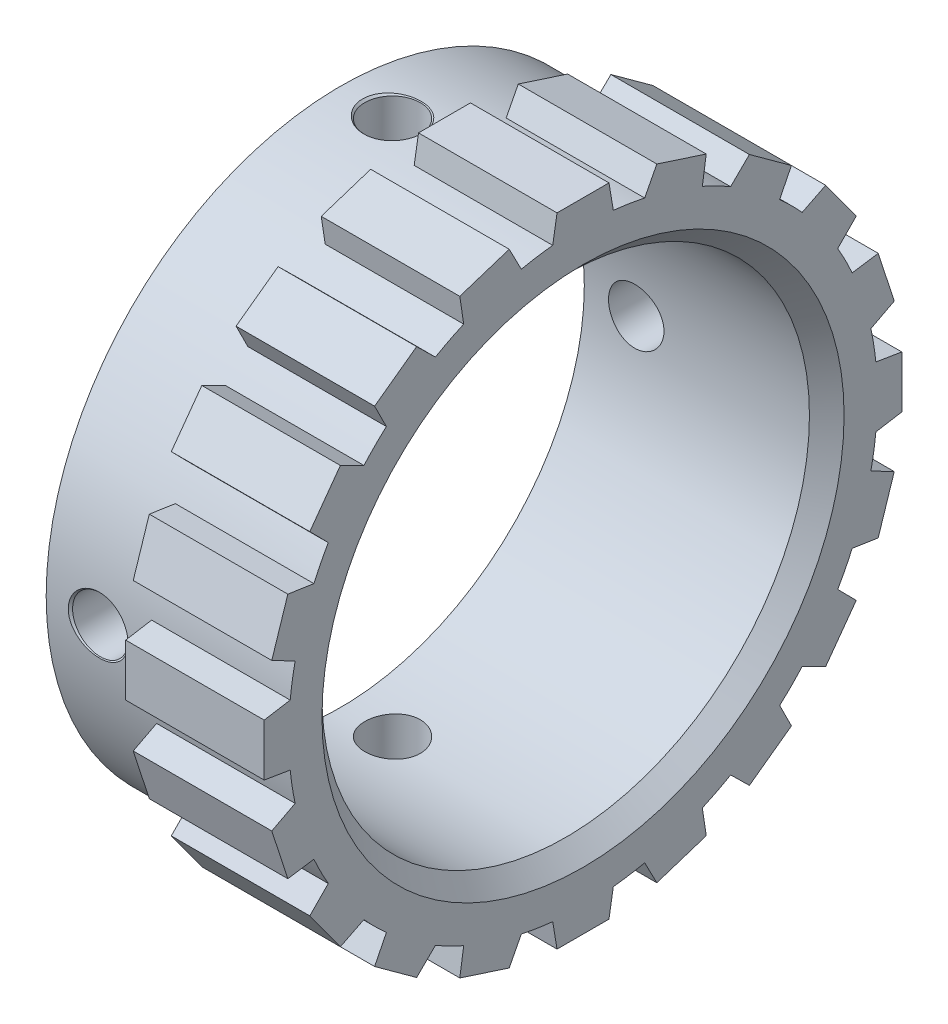
from build123d import *

# Parameters (mm, degrees)
SKETCH3_R           = 17
SKETCH3_R_2         = 14.075
BOSS_EXTRUDE2_DEPTH = 6
CIRPATTERN1_COUNT   = 4
CHAMFER1_SIZE       = 1
BOSS_EXTRUDE3_DEPTH = 4
CUT_EXTRUDE1_DEPTH  = 8
CIRPATTERN2_COUNT   = 20


# Read off the part's stored shape, not the designer's step: M3 Clearance Hole1
with BuildPart() as part:
    # Sketch2 → Revolve1 (revolve)
    with BuildSketch(Plane(origin=(0, 0, 0), x_dir=(1, 0, 0), z_dir=(0, 1, 0))):
        Polygon((-4, 2.925), (-1.5, 2.925), (0.5, 2.925), (4, 2.925), (4, 0), (-4, 0), align=None)
    revolve(axis=Axis((0, 0, 14.075), (-1, 0, 0)))

    # Sketch3 → Boss-Extrude2 (add)
    with BuildSketch(Plane.ZY.offset(4)):
        with Locations(Location((14.075, 0, 0), (0, 0, 180))):
            Circle(SKETCH3_R)
        with Locations(Location((14.075, 0, 0), (0, 0, 180))):
            Circle(SKETCH3_R_2, mode=Mode.SUBTRACT)
    extrude(amount=BOSS_EXTRUDE2_DEPTH)

    # M3 Clearance Hole1 outline → M3 Clearance Hole1 (revolve, cut)
    with BuildSketch(Plane(origin=(-7, 0, 0), x_dir=(1, 0, 0), z_dir=(0, -1, 0))):
        Polygon((1.6, -2.8), (1.6, 0.091276426), (0, 0.091276426), (0, -2.925000071), (1.725000071, -2.925000071), align=None)
    m3_clearance_hole1 = revolve(axis=Axis((-7, 0, 0), (0, 0, 1)), mode=Mode.SUBTRACT)

    # CirPattern1: M3 Clearance Hole1 ×4 about axis
    cirpattern1_axis = Axis((-10, 0, 14.075), (-1, 0, 0))
    for i in range(1, CIRPATTERN1_COUNT):
        add(m3_clearance_hole1.rotate(cirpattern1_axis, i * 360 / CIRPATTERN1_COUNT), mode=Mode.SUBTRACT)

    # Chamfer1
    chamfer1_edges = [part.edges().sort_by_distance(p)[0] for p in [
        (4, 0, 28.15),
    ]]
    chamfer(chamfer1_edges, length=CHAMFER1_SIZE)

    # Sketch12 → Boss-Extrude3 (add, symmetric)
    with BuildSketch(Plane(origin=(0, 0, 0), x_dir=(0, 0, -1), z_dir=(1, 0, 0))):
        with BuildLine():
            Line((2.834686573, 1.75), (4.334686573, 1.75))
            Line((4.334686573, 1.75), (4.334686573, -1.75))
            Line((4.334686573, -1.75), (2.834686573, -1.75))
            ThreePointArc((2.834686573, -1.75), (2.925, 0), (2.834686573, 1.75))
        make_face()
    boss_extrude3 = extrude(amount=BOSS_EXTRUDE3_DEPTH, both=True)

    # Sketch13 → Cut-Extrude1 (cut)
    with BuildSketch(Plane(origin=(4, 0, 0), x_dir=(0, 0, -1), z_dir=(1, 0, 0))):
        Polygon((2.834686573, 1.75), (4.334686573, 1.75), (4.334686573, 1.5), align=None)
        Polygon((2.834686573, -1.75), (4.334686573, -1.75), (4.334686573, -1.5), align=None)
    cut_extrude1 = extrude(amount=-CUT_EXTRUDE1_DEPTH, mode=Mode.SUBTRACT)

    # CirPattern2: Boss-Extrude3, Cut-Extrude1 ×20 about axis
    cirpattern2_axis = Axis((0, 0, 14.075), (1, 0, 0))
    add([boss_extrude3.rotate(cirpattern2_axis, i * 360 / CIRPATTERN2_COUNT) for i in range(1, CIRPATTERN2_COUNT)])
    add([cut_extrude1.rotate(cirpattern2_axis, i * 360 / CIRPATTERN2_COUNT) for i in range(1, CIRPATTERN2_COUNT)], mode=Mode.SUBTRACT)


solid = part.part
